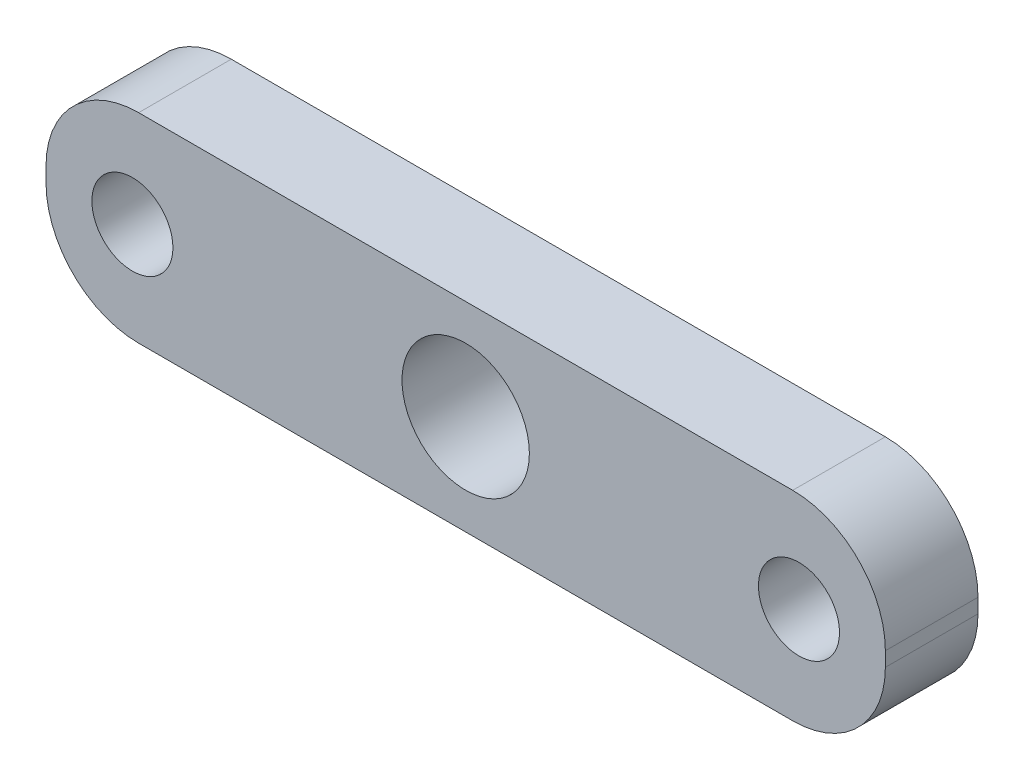
from build123d import *

# Parameters (mm, degrees)
SKETCH1_W           = 36.24
SKETCH1_H           = 8.62
SKETCH1_R           = 1.75
SKETCH1_R_2         = 2.75
BOSS_EXTRUDE1_DEPTH = 4
FILLET1_R           = 4


with BuildPart() as part:
    # Sketch1 → Boss-Extrude1 (new body)
    with BuildSketch(Plane.XY):
        Rectangle(SKETCH1_W, SKETCH1_H)
        with Locations((-14.39, 0)):
            Circle(SKETCH1_R, mode=Mode.SUBTRACT)
        with Locations((14.39, 0)):
            Circle(SKETCH1_R, mode=Mode.SUBTRACT)
        Circle(SKETCH1_R_2, mode=Mode.SUBTRACT)
    extrude(amount=BOSS_EXTRUDE1_DEPTH)

    # Fillet1
    fillet1_edges = [part.edges().sort_by_distance(p)[0] for p in [
        (18.12, -4.31, 2),
        (18.12, 4.31, 2),
        (-18.12, 4.31, 2),
        (-18.12, -4.31, 2),
    ]]
    fillet(fillet1_edges, radius=FILLET1_R)


solid = part.part
